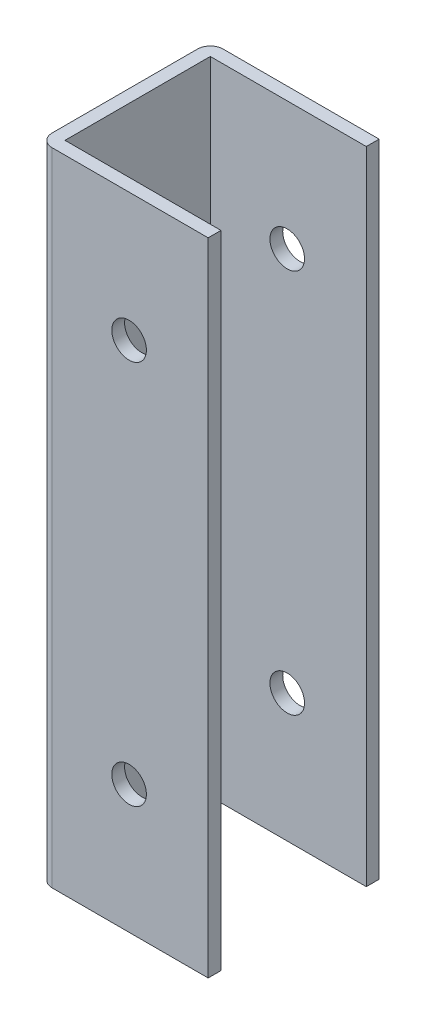
from build123d import *

# Parameters (mm, degrees)
SKETCH_1_W          = 74
SKETCH_1_H          = 34
EXTRUDE_1_DEPTH     = 150
SKETCH_2_W          = 41.646480438
SKETCH_2_H          = 42.526894273
CUT_EXTRUDE_1_DEPTH = 157.524758425
SKETCH_3_R          = 4.05
CUT_EXTRUDE_2_DEPTH = 161.312195419


with BuildPart() as part:
    # Эскиз1 → Вытянуть-Тонкостенный1 (new body)
    with BuildSketch(Plane(origin=(0, 0, 0), x_dir=(1, 0, 0), z_dir=(0, 1, 0))):
        with BuildLine():
            Line((40, 17), (40, -17))
            ThreePointArc((40, -17), (39.121320344, -19.121320344), (37, -20))
            Line((37, -20), (-37, -20))
            ThreePointArc((-37, -20), (-39.121320344, -19.121320344), (-40, -17))
            Line((-40, -17), (-40, 17))
            ThreePointArc((-40, 17), (-39.121320344, 19.121320344), (-37, 20))
            Line((-37, 20), (37, 20))
            ThreePointArc((37, 20), (39.121320344, 19.121320344), (40, 17))
        make_face()
        Rectangle(SKETCH_1_W, SKETCH_1_H, mode=Mode.SUBTRACT)
    extrude(amount=EXTRUDE_1_DEPTH)

    # Эскиз2 → Вырез-Вытянуть1 (cut, through all)
    with BuildSketch(Plane(origin=(0, 150, 0), x_dir=(1, 0, 0), z_dir=(0, 1, 0))):
        with Locations((20.323240219, -0.290673418)):
            Rectangle(SKETCH_2_W, SKETCH_2_H)
    extrude(amount=-CUT_EXTRUDE_1_DEPTH, mode=Mode.SUBTRACT)

    # Эскиз3 → Вырез-Вытянуть2 (cut, through all)
    with BuildSketch(Plane(origin=(0, 0, -20), x_dir=(-1, 0, 0), z_dir=(0, 0, -1))):
        with Locations((19, 120)):
            Circle(SKETCH_3_R)
        with Locations((19, 30)):
            Circle(SKETCH_3_R)
    extrude(amount=-CUT_EXTRUDE_2_DEPTH, mode=Mode.SUBTRACT)


solid = part.part
